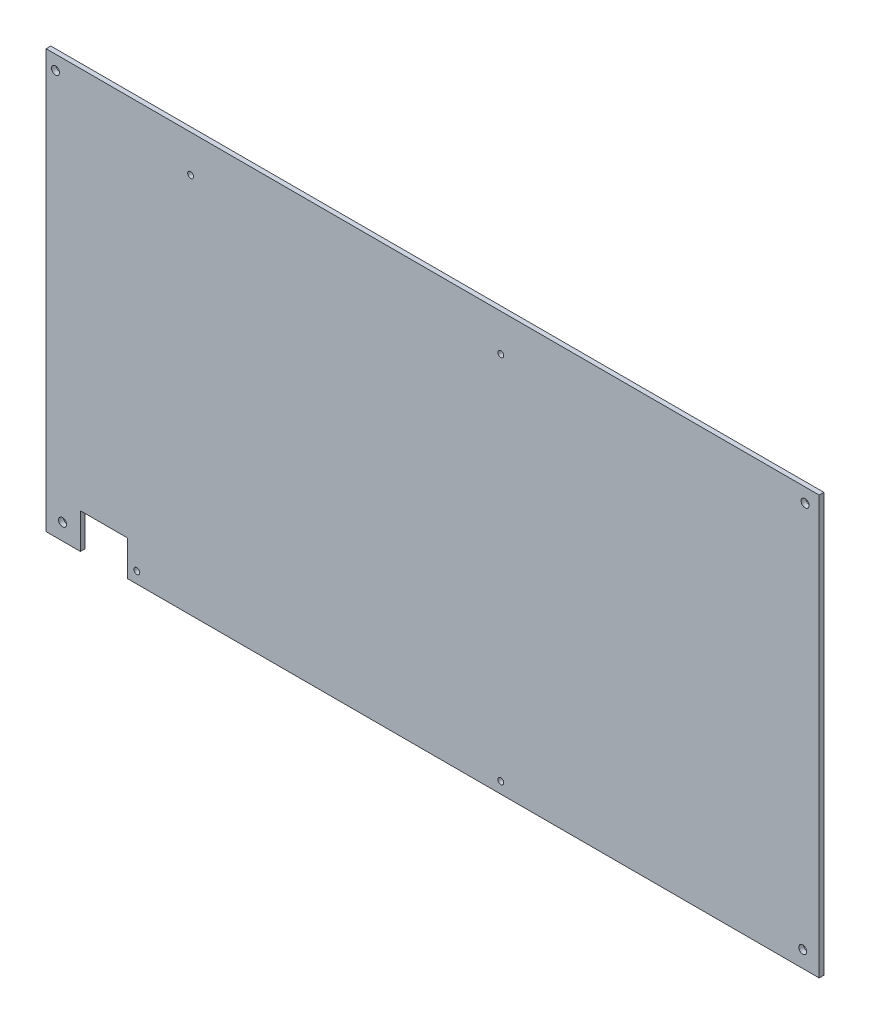
from build123d import *

# Parameters (mm, degrees)
SKETCH_1_W             = 329
SKETCH_1_H             = 178
SM_BASE_FLANGE_1_DEPTH = 2
HOLE_WIZARD_M3_3_D     = 3.4
HOLE_WIZARD_M3_1_D     = 2.5
SKETCH_20_W            = 20
SKETCH_20_H            = 15
CUT_EXTRUDE_1_DEPTH    = 10


# Sheet-metal steps are written as plain solids
with BuildPart() as part:
    # Sketch 1 → ﾍﾞｰｽ-ﾌﾗﾝｼﾞ1 (new body)
    with BuildSketch(Plane.XY):
        with Locations((164.5, 89)):
            Rectangle(SKETCH_1_W, SKETCH_1_H)
    extrude(amount=-SM_BASE_FLANGE_1_DEPTH)

    # M3 すきま穴3 (through all)
    with Locations(Plane.XY):
        with Locations((322, 7), (7, 7), (4, 172), (323, 172)):
            Hole(HOLE_WIZARD_M3_3_D / 2)

    # M3 ねじ穴1 (through all)
    with Locations(Plane.XY):
        with Locations((61.5, 162.2), (193.5, 162.2), (193.5, 4.8), (38.6, 4.8)):
            Hole(HOLE_WIZARD_M3_1_D / 2)

    # ｽｹｯﾁ20 → ｶｯﾄ - 押し出し1 (cut)
    with BuildSketch(Plane.XY):
        with Locations((24.6, 7.5)):
            Rectangle(SKETCH_20_W, SKETCH_20_H)
    extrude(amount=-CUT_EXTRUDE_1_DEPTH, mode=Mode.SUBTRACT)


solid = part.part
